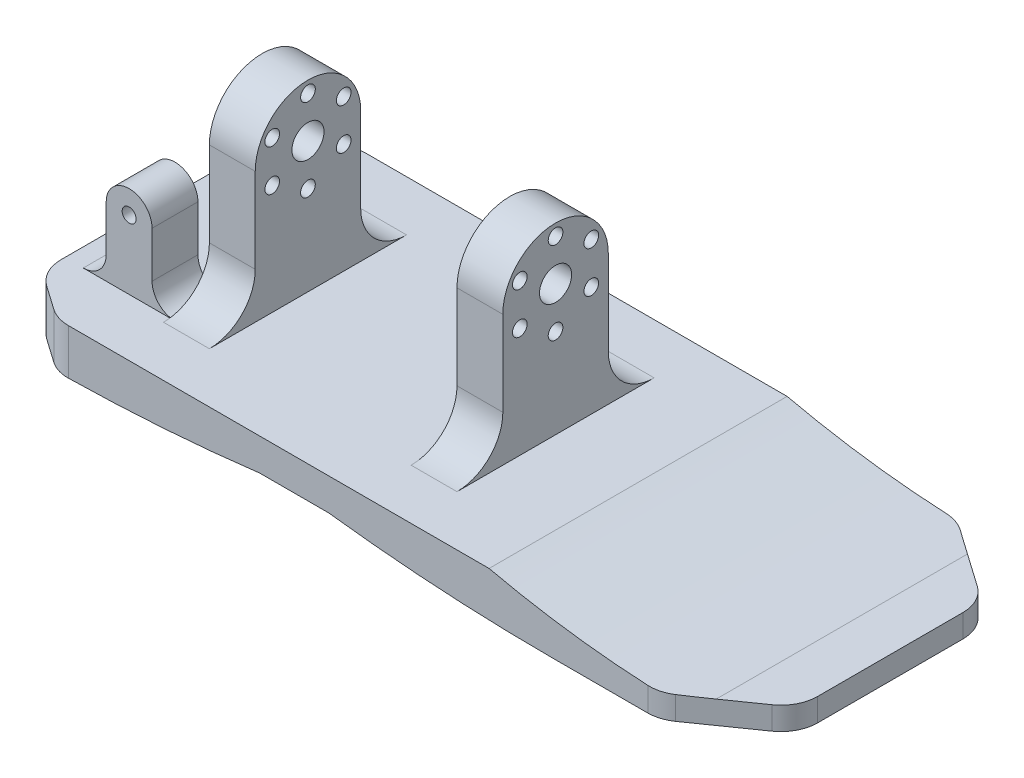
from build123d import *

# Parameters (mm, degrees)
BOSS_EXTRUDE1_DEPTH = 10
CUT_EXTRUDE1_REACH  = 131.77
SKETCH2_W           = 55
SKETCH2_H           = 5
SKETCH2_W_2         = 15
SKETCH2_H_2         = 3
FILLET2_R           = 200
SKETCH3_W           = 10
SKETCH3_H           = 23
BOSS_EXTRUDE2_DEPTH = 40
CUT_EXTRUDE2_REACH  = 124.348
SKETCH5_R           = 3.5
FILLET5_R           = 400
SKETCH6_W           = 10
SKETCH6_H           = 10
BOSS_EXTRUDE3_DEPTH = 20
CUT_EXTRUDE3_REACH  = 135.309
SKETCH7_R           = 1.525
CUT_EXTRUDE4_DEPTH  = 3
CUT_EXTRUDE5_DEPTH  = 3
FILLET6_R           = 5
CUT_EXTRUDE6_REACH  = 124.348
SKETCH11_R          = 1.6
CIRPATTERN1_COUNT   = 6
FILLET7_START       = -25.128912029
FILLET7_DEPTH       = 10
FILLET7_START_2     = 28.871087971
FILLET7_2_DEPTH     = 10
FILLET8_R           = 8


with BuildPart() as part:
    # Sketch1 → Boss-Extrude1 (new body)
    with BuildSketch(Plane(origin=(0, 0, 0), x_dir=(1, 0, 0), z_dir=(0, 1, 0))):
        Polygon((-37.417801979, -5), (94.019237886, -5), (111.871087971, -17.5), (111.871087971, -57.5), (94.019237886, -70), (-37.417801979, -70), (-48.128912029, -62.5), (-48.128912029, -12.5), align=None)
    extrude(amount=BOSS_EXTRUDE1_DEPTH)

    # Cut-Extrude1: up to this face of the body (flat: up to its plane)
    cut_extrude1_end = Plane(part.part.faces().sort_by_distance((28.300717954, 5, 5))[0])
    # Sketch2 → Cut-Extrude1 (cut, up to the picked face)
    with BuildSketch(Plane.XY.offset(70), mode=Mode.PRIVATE) as cut_extrude1_sk1:
        with Locations((84.371087971, 7.5)):
            Rectangle(SKETCH2_W, SKETCH2_H)
    cut_extrude1_tool1 = split(extrude(cut_extrude1_sk1.sketch, amount=-CUT_EXTRUDE1_REACH, mode=Mode.PRIVATE), bisect_by=cut_extrude1_end, keep=Keep.BOTH, mode=Mode.PRIVATE)
    # Sketch2 → Cut-Extrude1 (cut, up to the picked face)
    with BuildSketch(Plane.XY.offset(70), mode=Mode.PRIVATE) as cut_extrude1_sk2:
        with Locations((14.371087971, 1.5)):
            Rectangle(SKETCH2_W_2, SKETCH2_H_2)
    cut_extrude1_tool2 = split(extrude(cut_extrude1_sk2.sketch, amount=-CUT_EXTRUDE1_REACH, mode=Mode.PRIVATE), bisect_by=cut_extrude1_end, keep=Keep.BOTH, mode=Mode.PRIVATE)
    add(cut_extrude1_tool1.solids().sort_by(Axis((84.371088, 7.5, 70), (0, 0, -1)))[0], mode=Mode.SUBTRACT)
    add(cut_extrude1_tool2.solids().sort_by(Axis((14.371088, 1.5, 70), (0, 0, -1)))[0], mode=Mode.SUBTRACT)

    # Fillet2
    # the kernel refuses this fillet: 200 mm, written as the material it adds along each edge
    with BuildSketch(Plane(origin=(56.871087971, 5, 70), x_dir=(1, 0, 0), z_dir=(0, 0, -1))) as fillet2_piece_1_section:
        with BuildLine():
            CenterArc((44.440972087, -200), FILLET2_R, 90, 12.838568141)
            Line((0, -5), (0, 0))
            Line((0, 0), (44.440972087, 0))
        make_face()
    fillet2_piece_1 = extrude(amount=65, mode=Mode.PRIVATE)
    fillet2_piece_1 = split(fillet2_piece_1, bisect_by=Plane(origin=(99.632465325, 5, 8.930424166), z_dir=(-0.5735764363510472, 0, 0.8191520442889911)), keep=Keep.TOP, mode=Mode.PRIVATE)
    fillet2_piece_1 = split(fillet2_piece_1, bisect_by=Plane(origin=(69.092455149, 5, 87.453921176), z_dir=(-0.5735764363510469, 0, -0.8191520442889911)), keep=Keep.TOP, mode=Mode.PRIVATE)
    add(fillet2_piece_1)

    # Sketch3 → Boss-Extrude2 (add)
    with BuildSketch(Plane(origin=(0, 10, 0), x_dir=(1, 0, 0), z_dir=(0, 1, 0))):
        with Locations((-20.128912029, -37.5)):
            Rectangle(SKETCH3_W, SKETCH3_H)
        with Locations((33.871087971, -37.5)):
            Rectangle(SKETCH3_W, SKETCH3_H)
    extrude(amount=BOSS_EXTRUDE2_DEPTH)

    # Cut-Extrude2: up to this face of the body (flat: up to its plane)
    cut_extrude2_end = Plane(part.part.faces().sort_by_distance((-25.128912029, 30, 37.5))[0])
    # Sketch5 → Cut-Extrude2 (cut, up to the picked face)
    with BuildSketch(Plane(origin=(38.871087971, 0, 0), x_dir=(0, 0, -1), z_dir=(1, 0, 0)), mode=Mode.PRIVATE) as cut_extrude2_sk1:
        with Locations((-37.5, 38.5)):
            Circle(SKETCH5_R)
    cut_extrude2_tool1 = split(extrude(cut_extrude2_sk1.sketch, amount=-CUT_EXTRUDE2_REACH, mode=Mode.PRIVATE), bisect_by=cut_extrude2_end, keep=Keep.BOTH, mode=Mode.PRIVATE)
    # Sketch5 → Cut-Extrude2 (cut, up to the picked face)
    with BuildSketch(Plane(origin=(38.871087971, 0, 0), x_dir=(0, 0, -1), z_dir=(1, 0, 0)), mode=Mode.PRIVATE) as cut_extrude2_sk2:
        with BuildLine():
            Line((-49, 38.5), (-49, 52.545075055))
            Line((-49, 52.545075055), (-26, 52.545075055))
            Line((-26, 52.545075055), (-26, 38.5))
            ThreePointArc((-26, 38.5), (-37.5, 50), (-49, 38.5))
        make_face()
    cut_extrude2_tool2 = split(extrude(cut_extrude2_sk2.sketch, amount=-CUT_EXTRUDE2_REACH, mode=Mode.PRIVATE), bisect_by=cut_extrude2_end, keep=Keep.BOTH, mode=Mode.PRIVATE)
    add(cut_extrude2_tool1.solids().sort_by(Axis((38.871088, 38.5, 37.5), (-1, 0, 0)))[0], mode=Mode.SUBTRACT)
    add(cut_extrude2_tool2.solids().sort_by(Axis((38.871088, 45.522538, 48.730507), (-1, 0, 0)))[0], mode=Mode.SUBTRACT)

    # Fillet5
    # the kernel refuses this fillet: 400 mm, written as the material it takes off along each edge
    with BuildSketch(Plane(origin=(21.871087971, 0, 192.244631784), x_dir=(1, 0, 0), z_dir=(0, 0, -1))) as fillet5_piece_1:
        with BuildLine():
            CenterArc((48.897852714, -400), FILLET5_R, 90, 7.021664423)
            Line((0, -3), (0, 0))
            Line((0, 0), (48.897852714, 0))
        make_face()
    extrude(amount=309.489263568, mode=Mode.SUBTRACT)
    with BuildSketch(Plane(origin=(6.871087971, 0, 192.244631784), x_dir=(0, 1, 0), z_dir=(0, 0, -1))) as fillet5_piece_2:
        with BuildLine():
            CenterArc((400, -48.897852714), FILLET5_R, 172.978335577, 7.021664423)
            Line((0, -48.897852714), (0, 0))
            Line((0, 0), (3, 0))
        make_face()
    extrude(amount=309.489263568, mode=Mode.SUBTRACT)

    # Sketch6 → Boss-Extrude3 (add)
    with BuildSketch(Plane(origin=(0, 10, 0), x_dir=(1, 0, 0), z_dir=(0, 1, 0))):
        with Locations((-34.128912029, -22.5)):
            Rectangle(SKETCH6_W, SKETCH6_H)
        with Locations((-34.128912029, -52.5)):
            Rectangle(SKETCH6_W, SKETCH6_H)
    extrude(amount=BOSS_EXTRUDE3_DEPTH)

    # Cut-Extrude3: up to this face of the body (flat: up to its plane)
    cut_extrude3_end = Plane(part.part.faces().sort_by_distance((-34.128912029, 20, 57.5))[0])
    # Sketch7 → Cut-Extrude3 (cut, up to the picked face)
    with BuildSketch(Plane(origin=(0, 0, 17.5), x_dir=(-1, 0, 0), z_dir=(0, 0, -1)), mode=Mode.PRIVATE) as cut_extrude3_sk1:
        with Locations((34.128912029, 25)):
            Circle(SKETCH7_R)
    cut_extrude3_tool1 = split(extrude(cut_extrude3_sk1.sketch, amount=-CUT_EXTRUDE3_REACH, mode=Mode.PRIVATE), bisect_by=cut_extrude3_end, keep=Keep.BOTH, mode=Mode.PRIVATE)
    # Sketch7 → Cut-Extrude3 (cut, up to the picked face)
    with BuildSketch(Plane(origin=(0, 0, 17.5), x_dir=(-1, 0, 0), z_dir=(0, 0, -1)), mode=Mode.PRIVATE) as cut_extrude3_sk2:
        with BuildLine():
            Line((29.128912029, 25), (29.128912029, 43.961129652))
            Line((29.128912029, 43.961129652), (39.128912029, 43.961129652))
            Line((39.128912029, 43.961129652), (39.128912029, 25))
            ThreePointArc((39.128912029, 25), (34.128912029, 30), (29.128912029, 25))
        make_face()
    cut_extrude3_tool2 = split(extrude(cut_extrude3_sk2.sketch, amount=-CUT_EXTRUDE3_REACH, mode=Mode.PRIVATE), bisect_by=cut_extrude3_end, keep=Keep.BOTH, mode=Mode.PRIVATE)
    add(cut_extrude3_tool1.solids().sort_by(Axis((-34.128912, 25, 17.5), (0, 0, 1)))[0], mode=Mode.SUBTRACT)
    add(cut_extrude3_tool2.solids().sort_by(Axis((-34.128912, 36.402641, 17.5), (0, 0, 1)))[0], mode=Mode.SUBTRACT)

    # Sketch8 → Cut-Extrude4 (cut)
    with BuildSketch(Plane.XY.offset(27.5)):
        Polygon((-35.736832529, 27.785), (-37.344753029, 25), (-35.736832529, 22.215), (-32.52099153, 22.215), (-30.91307103, 25), (-32.52099153, 27.785), align=None)
    extrude(amount=-CUT_EXTRUDE4_DEPTH, mode=Mode.SUBTRACT)

    # Sketch9 → Cut-Extrude5 (cut)
    with BuildSketch(Plane(origin=(0, 0, 47.5), x_dir=(-1, 0, 0), z_dir=(0, 0, -1))):
        Polygon((35.736832529, 27.785), (32.52099153, 27.785), (30.91307103, 25), (32.52099153, 22.215), (35.736832529, 22.215), (37.344753029, 25), align=None)
    extrude(amount=-CUT_EXTRUDE5_DEPTH, mode=Mode.SUBTRACT)

    # Fillet6
    # the kernel refuses this fillet: 5 mm, written as the material it adds along each edge
    with BuildSketch(Plane(origin=(-39.128912029, 10, 27.5), x_dir=(-1, 0, 0), z_dir=(0, 0, -1)), Plane(origin=(-29.128912029, 10, 17.5), x_dir=(1, 0, 0), z_dir=(0, 0, 1))) as fillet6_piece_1:
        with BuildLine():
            CenterArc((FILLET6_R, FILLET6_R), FILLET6_R, 180, 90)
            Line((0, FILLET6_R), (0, 0))
            Line((0, 0), (FILLET6_R, 0))
        make_face()
    extrude(amount=10)
    with BuildSketch(Plane(origin=(-39.128912029, 10, 47.5), x_dir=(-1, 0, 0), z_dir=(0, 0, 1)), Plane(origin=(-29.128912029, 10, 57.5), x_dir=(1, 0, 0), z_dir=(0, 0, -1))) as fillet6_piece_2:
        with BuildLine():
            CenterArc((FILLET6_R, -FILLET6_R), FILLET6_R, 90, 90)
            Line((0, -FILLET6_R), (0, 0))
            Line((0, 0), (FILLET6_R, 0))
        make_face()
    extrude(amount=10)

    # Cut-Extrude6: up to this face of the body (flat: up to its plane)
    cut_extrude6_end = Plane(part.part.faces().sort_by_distance((-25.128912029, 28.410444613, 37.5))[0])
    # Sketch11 → Cut-Extrude6 (cut, up to the picked face)
    with BuildSketch(Plane(origin=(38.871087971, 0, 0), x_dir=(0, 0, -1), z_dir=(1, 0, 0)), mode=Mode.PRIVATE) as cut_extrude6_sk1:
        with Locations((-37.5, 47.5)):
            Circle(SKETCH11_R)
    cut_extrude6_tool1 = split(extrude(cut_extrude6_sk1.sketch, amount=-CUT_EXTRUDE6_REACH, mode=Mode.PRIVATE), bisect_by=cut_extrude6_end, keep=Keep.BOTH, mode=Mode.PRIVATE)
    cut_extrude6 = cut_extrude6_tool1.solids().sort_by(Axis((38.871088, 47.5, 37.5), (-1, 0, 0)))[0]
    add(cut_extrude6, mode=Mode.SUBTRACT)

    # CirPattern1: Cut-Extrude6 ×6 about axis
    cirpattern1_axis = Axis((0, 38.5, 37.5), (1, 0, 0))
    for i in range(1, CIRPATTERN1_COUNT):
        add(cut_extrude6.rotate(cirpattern1_axis, i * 360 / CIRPATTERN1_COUNT), mode=Mode.SUBTRACT)

    # Fillet7: read off the stored shape, not the designer's step
    # Fillet7 outline → Fillet7 (add)
    with BuildSketch(Plane.YZ.offset(FILLET7_START)):
        with BuildLine():
            Line((10, 49), (20, 49))
            ThreePointArc((20, 49), (12.928932188, 51.928932188), (10, 59))
            Line((10, 59), (10, 49))
        make_face()
        with BuildLine():
            Line((20, 26), (10, 26))
            Line((10, 26), (10, 16))
            ThreePointArc((10, 16), (12.928932188, 23.071067812), (20, 26))
        make_face()
    extrude(amount=FILLET7_DEPTH)

    # Fillet7 2 outline → Fillet7 2 (add)
    with BuildSketch(Plane.YZ.offset(FILLET7_START_2)):
        with BuildLine():
            Line((10, 49), (20, 49))
            ThreePointArc((20, 49), (12.928932188, 51.928932188), (10, 59))
            Line((10, 59), (10, 49))
        make_face()
        with BuildLine():
            Line((20, 26), (10, 26))
            Line((10, 26), (10, 16))
            ThreePointArc((10, 16), (12.928932188, 23.071067812), (20, 26))
        make_face()
    extrude(amount=FILLET7_2_DEPTH)

    # Fillet8
    fillet8_edges = [part.edges().sort_by_distance(p)[0] for p in [
        (-48.128912029, 5, 12.5),
        (-37.417801979, 5.013277027, 5),
        (-48.128912029, 5, 62.5),
        (-37.417801979, 5.013277027, 70),
        (94.019237886, 2.566503683, 5),
        (111.871087971, 2.5, 17.5),
        (94.019237886, 2.566503683, 70),
        (111.871087971, 2.5, 57.5),
    ]]
    fillet(fillet8_edges, radius=FILLET8_R)


solid = part.part
